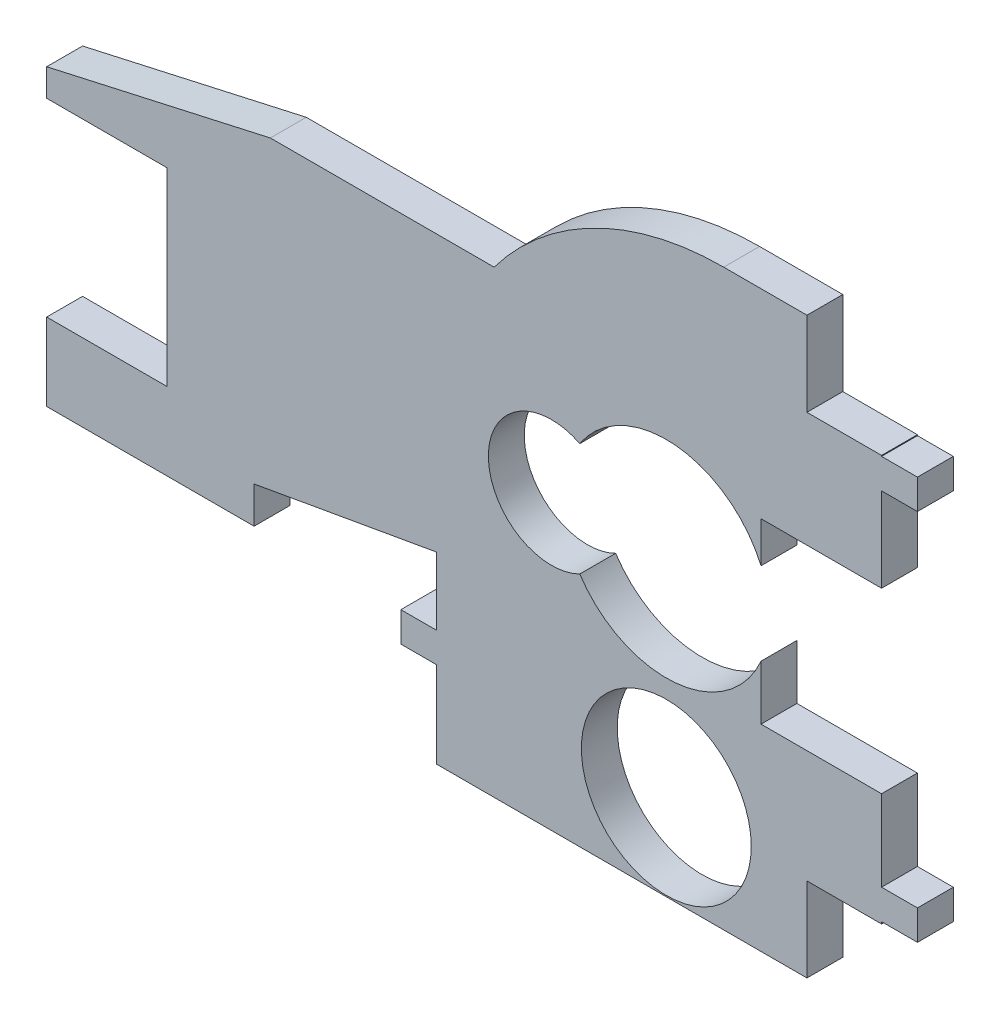
from build123d import *

# Parameters (mm, degrees)
SKETCH1_R           = 3.7592
BOSS_EXTRUDE1_DEPTH = 1.5875
CUT_EXTRUDE1_REACH  = 36.935
SKETCH2_W           = 3.302
SKETCH2_H           = 3.7211


with BuildPart() as part:
    # Sketch1 → Boss-Extrude1 (new body)
    with BuildSketch(Plane.XY):
        with BuildLine():
            Line((11.1125, 17.8308), (9.525, 17.8308))
            Line((9.525, 17.8308), (9.525, 21.59))
            Line((9.525, 21.59), (2.54, 21.59))
            ThreePointArc((2.54, 21.59), (-3.139612663, 20.249225326), (-7.62, 16.51))
            Line((-7.62, 16.51), (-17.51946076, 16.51))
            Line((-17.51946076, 16.51), (-27.418921519, 14.291751972))
            Line((-27.418921519, 14.291751972), (-27.418921519, 13.081))
            Line((-27.418921519, 13.081), (-22.084921519, 13.081))
            Line((-22.084921519, 13.081), (-22.084921519, 4.699))
            Line((-22.084921519, 4.699), (-27.418921519, 4.699))
            Line((-27.418921519, 4.699), (-27.418921519, 1.27))
            Line((-27.418921519, 1.27), (-18.241771939, 1.27))
            Line((-18.241771939, 1.27), (-18.241771939, 2.890724209))
            Line((-18.241771939, 2.890724209), (-10.16, 4.318))
            Line((-10.16, 4.318), (-10.16, 1.3208))
            Line((-10.16, 1.3208), (-11.7475, 1.3208))
            Line((-11.7475, 1.3208), (-11.7475, 0))
            Line((-11.7475, 0), (-10.16, 0))
            Line((-10.16, 0), (-10.16, -3.81))
            Line((-10.16, -3.81), (9.525, -3.81))
            Line((9.525, -3.81), (9.525, 0))
            Line((9.525, 0), (11.1125, 0))
            Line((11.1125, 0), (11.1125, 1.3208))
            Line((11.1125, 1.3208), (9.525, 1.3208))
            Line((9.525, 1.3208), (9.525, 4.9022))
            Line((9.525, 4.9022), (4.191, 4.9022))
            Line((4.191, 4.9022), (4.191, 7.31678819))
            ThreePointArc((4.191, 7.31678819), (0.381242222, 4.587922919), (-3.82905, 6.645688551))
            ThreePointArc((-3.82905, 6.645688551), (-7.874, 9.144), (-3.82905, 11.642311449))
            ThreePointArc((-3.82905, 11.642311449), (0.381242222, 13.700077081), (4.191, 10.97121181))
            Line((4.191, 10.97121181), (4.191, 12.7762))
            Line((4.191, 12.7762), (9.525, 12.7762))
            Line((9.525, 12.7762), (9.525, 16.51))
            Line((9.525, 16.51), (11.1125, 16.51))
            Line((11.1125, 16.51), (11.1125, 17.8308))
        make_face()
        Circle(SKETCH1_R, mode=Mode.SUBTRACT)
    extrude(amount=BOSS_EXTRUDE1_DEPTH)

    # Sketch2 → Cut-Extrude1 (cut, up to next)
    with BuildSketch(Plane.XY.offset(1.5875), mode=Mode.PRIVATE) as cut_extrude1_sk1:
        with Locations((7.874, -1.94945)):
            Rectangle(SKETCH2_W, SKETCH2_H)
    cut_extrude1_tool1 = extrude(cut_extrude1_sk1.sketch, amount=-CUT_EXTRUDE1_REACH, mode=Mode.PRIVATE) & part.part
    # Sketch2 → Cut-Extrude1 (cut, up to next)
    with BuildSketch(Plane.XY.offset(1.5875), mode=Mode.PRIVATE) as cut_extrude1_sk2:
        with Locations((7.874, 19.72945)):
            Rectangle(SKETCH2_W, SKETCH2_H)
    cut_extrude1_tool2 = extrude(cut_extrude1_sk2.sketch, amount=-CUT_EXTRUDE1_REACH, mode=Mode.PRIVATE) & part.part
    add(cut_extrude1_tool1.solids().sort_by_distance((7.874, -1.94945, 1.5875))[0], mode=Mode.SUBTRACT)
    add(cut_extrude1_tool2.solids().sort_by_distance((7.874, 19.72945, 1.5875))[0], mode=Mode.SUBTRACT)


solid = part.part
